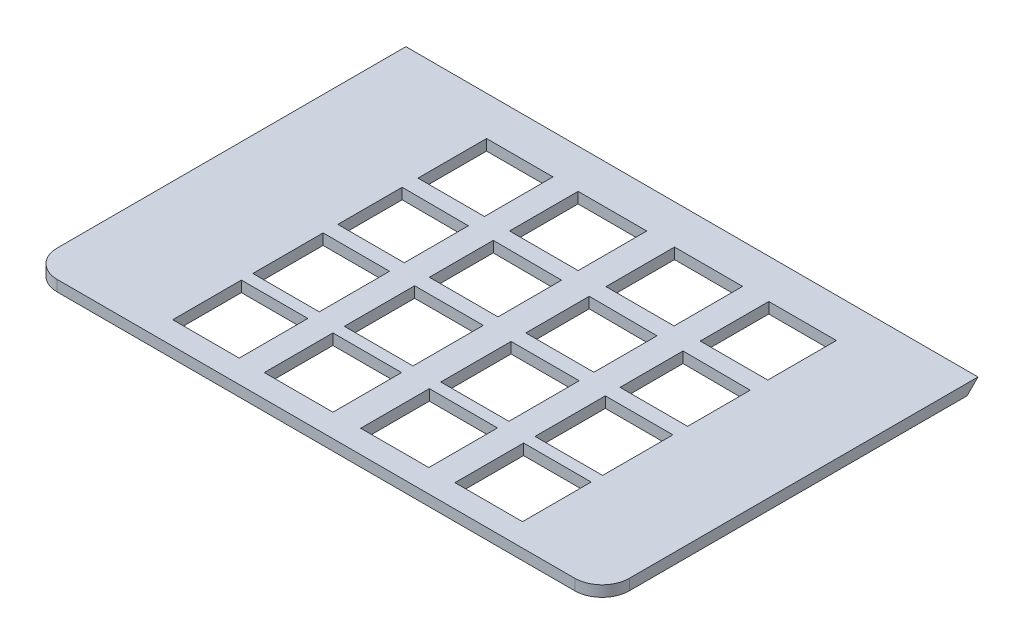
from build123d import *

# Parameters (mm, degrees)
SKETCH2_W           = 105
SKETCH2_H           = 69
SKETCH2_W_2         = 12.176237233
SKETCH2_H_2         = 12
SKETCH2_W_3         = 12
SKETCH2_W_4         = 11
SKETCH2_H_3         = 11
SKETCH2_W_5         = 10.781198293
BOSS_EXTRUDE1_DEPTH = 2
FILLET1_R           = 5
FILLET2_R           = 5
CHAMFER1_SIZE       = 2
SKETCH3_W           = 12.4
SKETCH3_H           = 12.584292926
SKETCH3_W_2         = 12.5
SKETCH3_W_3         = 12.6
SKETCH3_W_4         = 12.2
SKETCH3_H_2         = 12.9
SKETCH3_H_3         = 12.6
CUT_EXTRUDE1_DEPTH  = 10
SKETCH4_W           = 0.6
SKETCH4_H           = 11
BOSS_EXTRUDE2_DEPTH = 2
SKETCH5_W           = 0.6
SKETCH5_H           = 11
BOSS_EXTRUDE3_DEPTH = 2
SKETCH6_W           = 0.8
SKETCH6_H           = 11
SKETCH6_W_2         = 0.4
SKETCH6_W_3         = 0.776237233
BOSS_EXTRUDE4_DEPTH = 2


with BuildPart() as part:
    # Sketch2 → Boss-Extrude1 (new body)
    with BuildSketch(Plane(origin=(0, 0, 0), x_dir=(1, 0, 0), z_dir=(0, 1, 0))):
        with Locations((0, -41.5)):
            Rectangle(SKETCH2_W, SKETCH2_H)
        with Locations((-23.611881384, -66)):
            Rectangle(SKETCH2_W_2, SKETCH2_H_2, mode=Mode.SUBTRACT)
        with Locations((11.3, -66)):
            Rectangle(SKETCH2_W_3, SKETCH2_H_2, mode=Mode.SUBTRACT)
        with Locations((28.8, -66)):
            Rectangle(SKETCH2_W_4, SKETCH2_H_2, mode=Mode.SUBTRACT)
        with Locations((28.8, -20.5)):
            Rectangle(SKETCH2_W_4, SKETCH2_H_3, mode=Mode.SUBTRACT)
        with Locations((11.3, -20.5)):
            Rectangle(SKETCH2_W_3, SKETCH2_H_3, mode=Mode.SUBTRACT)
        with Locations((-6.090599146, -20.5)):
            Rectangle(SKETCH2_W_5, SKETCH2_H_3, mode=Mode.SUBTRACT)
        with Locations((-6.090599146, -66)):
            Rectangle(SKETCH2_W_5, SKETCH2_H_2, mode=Mode.SUBTRACT)
        with Locations((-23.611881384, -20.5)):
            Rectangle(SKETCH2_W_2, SKETCH2_H_3, mode=Mode.SUBTRACT)
        with Locations((-23.611881384, -35.5)):
            Rectangle(SKETCH2_W_2, SKETCH2_H_3, mode=Mode.SUBTRACT)
        with Locations((-23.611881384, -50.5)):
            Rectangle(SKETCH2_W_2, SKETCH2_H_3, mode=Mode.SUBTRACT)
        with Locations((28.8, -50.5)):
            Rectangle(SKETCH2_W_4, SKETCH2_H_3, mode=Mode.SUBTRACT)
        with Locations((28.8, -35.5)):
            Rectangle(SKETCH2_W_4, SKETCH2_H_3, mode=Mode.SUBTRACT)
        with Locations((11.3, -50.5)):
            Rectangle(SKETCH2_W_3, SKETCH2_H_3, mode=Mode.SUBTRACT)
        with Locations((-6.090599146, -50.5)):
            Rectangle(SKETCH2_W_5, SKETCH2_H_3, mode=Mode.SUBTRACT)
        with Locations((-6.090599146, -35.5)):
            Rectangle(SKETCH2_W_5, SKETCH2_H_3, mode=Mode.SUBTRACT)
        with Locations((11.3, -35.5)):
            Rectangle(SKETCH2_W_3, SKETCH2_H_3, mode=Mode.SUBTRACT)
    extrude(amount=BOSS_EXTRUDE1_DEPTH)

    # Fillet1
    fillet1_edges = [part.edges().sort_by_distance(p)[0] for p in [
        (-52.5, 1, 76),
    ]]
    fillet(fillet1_edges, radius=FILLET1_R)

    # Fillet2
    fillet2_edges = [part.edges().sort_by_distance(p)[0] for p in [
        (52.5, 1, 76),
    ]]
    fillet(fillet2_edges, radius=FILLET2_R)

    # Chamfer1
    chamfer1_edges = [part.edges().sort_by_distance(p)[0] for p in [
        (0, 0, 7),
    ]]
    chamfer(chamfer1_edges, length=CHAMFER1_SIZE - 0.0001)  # a hair under: the kernel refuses the full size

    # Sketch3 → Cut-Extrude1 (cut)
    with BuildSketch(Plane(origin=(0, 2, 0), x_dir=(1, 0, 0), z_dir=(0, 1, 0))):
        with Locations((27.5, -20.492146463)):
            Rectangle(SKETCH3_W, SKETCH3_H)
        with Locations((10.25, -20.492146463)):
            Rectangle(SKETCH3_W_2, SKETCH3_H)
        with Locations((-7.4, -20.492146463)):
            Rectangle(SKETCH3_W_3, SKETCH3_H)
        with Locations((-24.4, -20.492146463)):
            Rectangle(SKETCH3_W_4, SKETCH3_H)
        Polygon((-30.5, -41.5), (-18.3, -41.5), (-18.3, -29.743553264), (-30.5, -29.683386914), align=None)
        Polygon((-13.7, -41.5), (-1.1, -41.5), (-1.1, -29.828377953), (-13.7, -29.766238937), align=None)
        Polygon((4, -41.5), (16.5, -41.5), (16.5, -29.91517531), (4, -29.85352946), align=None)
        Polygon((21.3, -41.5), (33.7, -41.5), (33.7, -30), (21.3, -29.938847317), align=None)
        with Locations((27.5, -50.65)):
            Rectangle(SKETCH3_W, SKETCH3_H_2)
        with Locations((10.25, -50.65)):
            Rectangle(SKETCH3_W_2, SKETCH3_H_2)
        with Locations((-7.4, -50.65)):
            Rectangle(SKETCH3_W_3, SKETCH3_H_2)
        with Locations((-24.4, -50.65)):
            Rectangle(SKETCH3_W_4, SKETCH3_H_2)
        with Locations((-24.4, -65.5)):
            Rectangle(SKETCH3_W_4, SKETCH3_H_3)
        with Locations((-7.4, -65.5)):
            Rectangle(SKETCH3_W_3, SKETCH3_H_3)
        with Locations((10.25, -65.5)):
            Rectangle(SKETCH3_W_2, SKETCH3_H_3)
        with Locations((27.5, -65.5)):
            Rectangle(SKETCH3_W, SKETCH3_H_3)
    extrude(amount=-CUT_EXTRUDE1_DEPTH, mode=Mode.SUBTRACT)

    # Sketch4 → Boss-Extrude2 (add)
    with BuildSketch(Plane(origin=(0, 2, 0), x_dir=(1, 0, 0), z_dir=(0, 1, 0))):
        with Locations((34, -20.5)):
            Rectangle(SKETCH4_W, SKETCH4_H)
    extrude(amount=-BOSS_EXTRUDE2_DEPTH)

    # Sketch5 → Boss-Extrude3 (add)
    with BuildSketch(Plane(origin=(0, 2, 0), x_dir=(1, 0, 0), z_dir=(0, 1, 0))):
        with Locations((34, -35.5)):
            Rectangle(SKETCH5_W, SKETCH5_H)
        with Locations((34, -50.5)):
            Rectangle(SKETCH5_W, SKETCH5_H)
        Polygon((33.7, -60), (34.3, -60), (34.3, -72), (23.3, -72), (23.3, -71.8), (33.7, -71.8), align=None)
    extrude(amount=-BOSS_EXTRUDE3_DEPTH)

    # Sketch6 → Boss-Extrude4 (add)
    with BuildSketch(Plane(origin=(0, 2, 0), x_dir=(1, 0, 0), z_dir=(0, 1, 0))):
        with Locations((16.9, -20.5)):
            Rectangle(SKETCH6_W, SKETCH6_H)
        with Locations((16.9, -35.5)):
            Rectangle(SKETCH6_W, SKETCH6_H)
        with Locations((16.9, -50.5)):
            Rectangle(SKETCH6_W, SKETCH6_H)
        Polygon((16.5, -60), (17.3, -60), (17.3, -72), (5.3, -72), (5.3, -71.8), (16.5, -71.8), align=None)
        Polygon((-1.1, -60), (-0.7, -60), (-0.7, -72), (-11.481198293, -72), (-11.481198293, -71.8), (-1.1, -71.8), align=None)
        Polygon((-18.3, -60), (-17.523762767, -60), (-17.523762767, -72), (-29.7, -72), (-29.7, -71.8), (-18.3, -71.8), align=None)
        with Locations((-0.9, -50.5)):
            Rectangle(SKETCH6_W_2, SKETCH6_H)
        with Locations((-0.9, -35.5)):
            Rectangle(SKETCH6_W_2, SKETCH6_H)
        with Locations((-0.9, -20.5)):
            Rectangle(SKETCH6_W_2, SKETCH6_H)
        with Locations((-17.911881384, -20.5)):
            Rectangle(SKETCH6_W_3, SKETCH6_H)
        with Locations((-17.911881384, -35.5)):
            Rectangle(SKETCH6_W_3, SKETCH6_H)
        with Locations((-17.911881384, -50.5)):
            Rectangle(SKETCH6_W_3, SKETCH6_H)
    extrude(amount=-BOSS_EXTRUDE4_DEPTH)


solid = part.part
